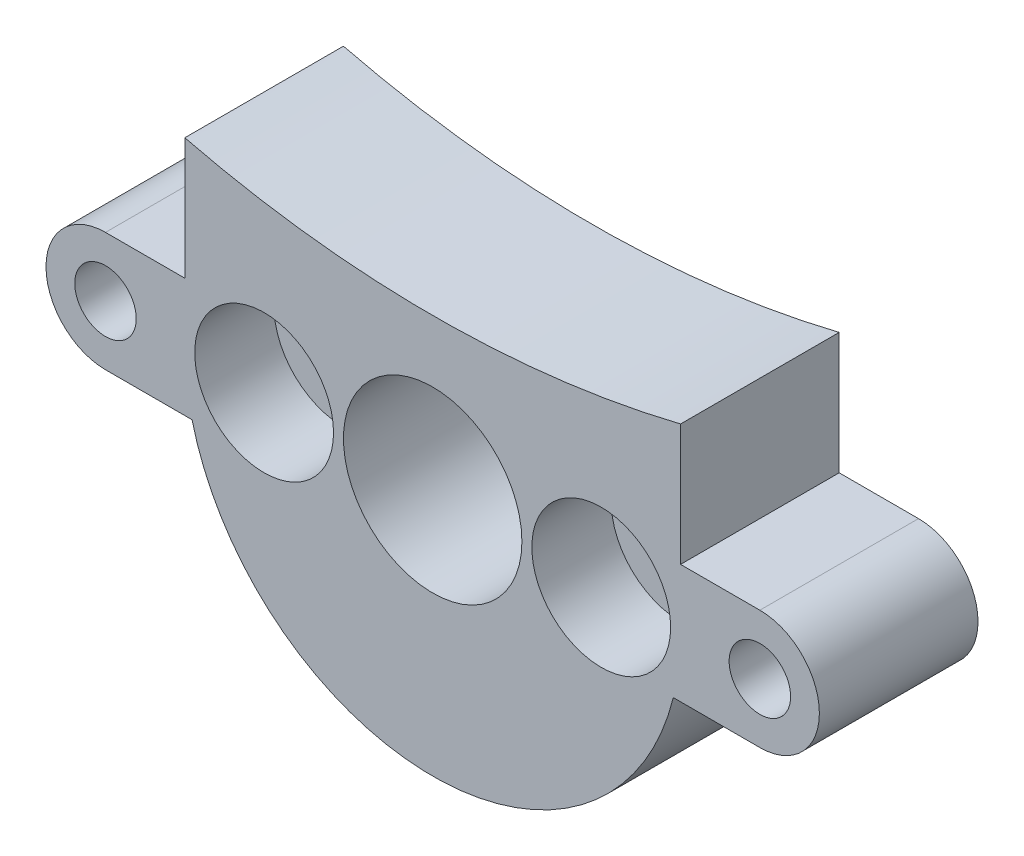
from build123d import *

# Parameters (mm, degrees)
SKETCH1_R           = 1.55
SKETCH1_R_2         = 4.5
BOSS_EXTRUDE1_DEPTH = 8
SKETCH2_R           = 3.5
CUT_EXTRUDE1_DEPTH  = 4


with BuildPart() as part:
    # Sketch1 → Boss-Extrude1 (new body)
    with BuildSketch(Plane.XY):
        with BuildLine():
            Line((-16.5, 3), (-12.5, 3))
            Line((-12.5, 3), (-12.5, 9.132525127))
            ThreePointArc((-12.5, 9.132525127), (0, 7.619182901), (12.5, 9.132525127))
            Line((12.5, 9.132525127), (12.5, 3))
            Line((12.5, 3), (16.5, 3))
            ThreePointArc((16.5, 3), (19.5, 0), (16.5, -3))
            Line((16.5, -3), (12.1346611, -3))
            ThreePointArc((12.1346611, -3), (0, -12.5), (-12.1346611, -3))
            Line((-12.1346611, -3), (-16.5, -3))
            ThreePointArc((-16.5, -3), (-19.5, 0), (-16.5, 3))
        make_face()
        with Locations((-8.5, 0)):
            Circle(SKETCH1_R, mode=Mode.SUBTRACT)
        with Locations((8.5, 0)):
            Circle(SKETCH1_R, mode=Mode.SUBTRACT)
        Circle(SKETCH1_R_2, mode=Mode.SUBTRACT)
        with Locations((-16.5, 0)):
            Circle(SKETCH1_R, mode=Mode.SUBTRACT)
        with Locations((16.5, 0)):
            Circle(SKETCH1_R, mode=Mode.SUBTRACT)
    extrude(amount=BOSS_EXTRUDE1_DEPTH)

    # Sketch2 → Cut-Extrude1 (cut)
    with BuildSketch(Plane.XY.offset(8)):
        with Locations((-8.5, 0)):
            Circle(SKETCH2_R)
        with Locations((8.5, 0)):
            Circle(SKETCH2_R)
    extrude(amount=-CUT_EXTRUDE1_DEPTH, mode=Mode.SUBTRACT)


solid = part.part
